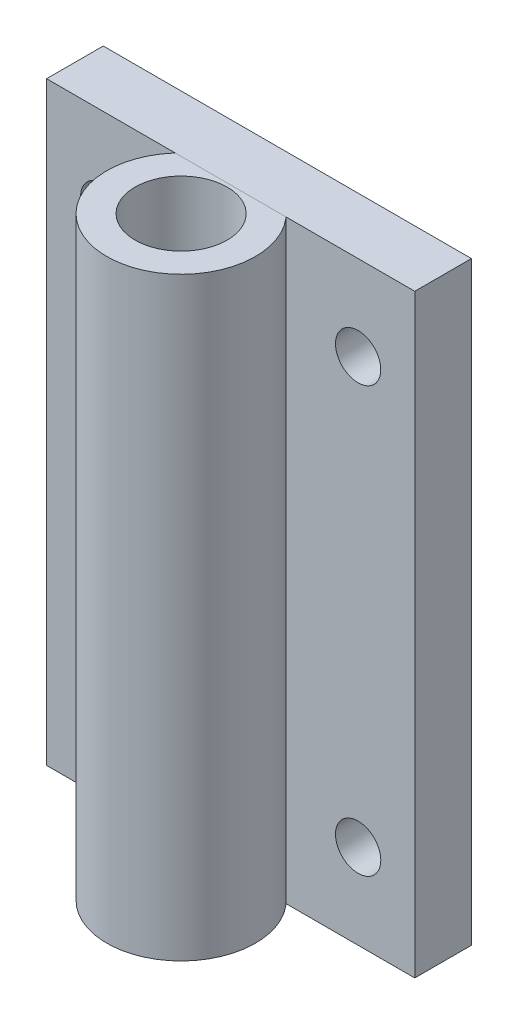
from build123d import *

# Parameters (mm, degrees)
SKETCH_1_W      = 26
SKETCH_1_H      = 42
SKETCH_1_R      = 1.6
EXTRUDE_1_DEPTH = 4
SKETCH_3_R      = 5.25
SKETCH_3_R_2    = 3.25
EXTRUDE_2_DEPTH = 21


with BuildPart() as part:
    # 草图1 → 凸台-拉伸1 (new body)
    with BuildSketch(Plane.XY):
        Rectangle(SKETCH_1_W, SKETCH_1_H)
        with Locations((-9, 15)):
            Circle(SKETCH_1_R, mode=Mode.SUBTRACT)
        with Locations((-9, -15)):
            Circle(SKETCH_1_R, mode=Mode.SUBTRACT)
        with Locations((9, -15)):
            Circle(SKETCH_1_R, mode=Mode.SUBTRACT)
        with Locations((9, 15)):
            Circle(SKETCH_1_R, mode=Mode.SUBTRACT)
    extrude(amount=EXTRUDE_1_DEPTH)


with BuildPart() as body_2:
    # 草图3 → 凸台-拉伸2 (new, symmetric)
    with BuildSketch(Plane(origin=(0, 0, 0), x_dir=(1, 0, 0), z_dir=(0, 1, 0))):
        with Locations((0, -7.5)):
            Circle(SKETCH_3_R)
        with Locations((0, -7.5)):
            Circle(SKETCH_3_R_2, mode=Mode.SUBTRACT)
    extrude(amount=EXTRUDE_2_DEPTH, both=True)


solid = Compound([part.part, body_2.part])
